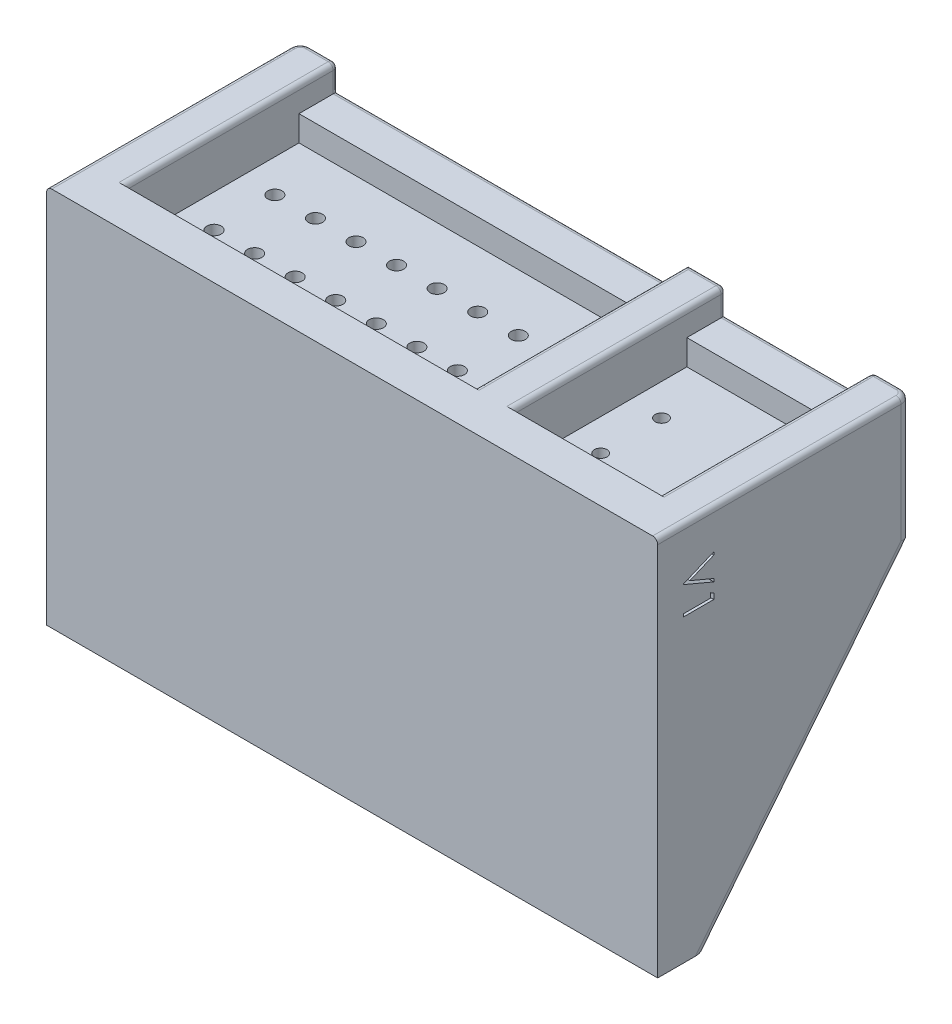
from build123d import *

# Parameters (mm, degrees)
SKETCH1_W           = 120.5
SKETCH1_H           = 50
BOSS_EXTRUDE1_DEPTH = 25
SKETCH2_W           = 29
SKETCH2_H           = 34.5
CUT_EXTRUDE1_DEPTH  = 10
SKETCH3_W           = 69
SKETCH3_H           = 34.5
CUT_EXTRUDE2_DEPTH  = 10
SKETCH5_R           = 1.4
CUT_EXTRUDE4_DEPTH  = 67.933269007
SKETCH6_R           = 1.25
CUT_EXTRUDE5_DEPTH  = 67.933269007
SKETCH8_W           = 69
SKETCH8_H           = 7.75
SKETCH8_W_2         = 29
CUT_EXTRUDE7_DEPTH  = 5
FILLET1_R           = 1
SKETCH9_W           = 120.5
SKETCH9_H           = 10
BOSS_EXTRUDE2_DEPTH = 50
BOSS_EXTRUDE3_DEPTH = 10
FILLET3_R           = 2
SKETCH11_W          = 100.5
SKETCH11_H          = 24
RECESS_DEPTH        = 2
CUT_EXTRUDE9_DEPTH  = 2


with BuildPart() as part:
    # Sketch1 → Boss-Extrude1 (new body)
    with BuildSketch(Plane(origin=(0, 0, 0), x_dir=(1, 0, 0), z_dir=(0, 1, 0))):
        Rectangle(SKETCH1_W, SKETCH1_H)
    extrude(amount=BOSS_EXTRUDE1_DEPTH)

    # Sketch2 → Cut-Extrude1 (cut)
    with BuildSketch(Plane(origin=(0, 25, 0), x_dir=(1, 0, 0), z_dir=(0, 1, 0))):
        with Locations((38.25, 0)):
            Rectangle(SKETCH2_W, SKETCH2_H)
    extrude(amount=-CUT_EXTRUDE1_DEPTH, mode=Mode.SUBTRACT)

    # Sketch3 → Cut-Extrude2 (cut)
    with BuildSketch(Plane(origin=(0, 25, 0), x_dir=(1, 0, 0), z_dir=(0, 1, 0))):
        with Locations((-18.25, 0)):
            Rectangle(SKETCH3_W, SKETCH3_H)
    extrude(amount=-CUT_EXTRUDE2_DEPTH, mode=Mode.SUBTRACT)

    # Sketch5 → Cut-Extrude4 (cut, through all)
    with BuildSketch(Plane(origin=(0, 15, 0), x_dir=(1, 0, 0), z_dir=(0, 1, 0))):
        with Locations(Location((-46.25, 6, 0), (0, 0, 270))):
            Circle(SKETCH5_R)
        with Locations(Location((-38.25, 6, 0), (0, 0, 270))):
            Circle(SKETCH5_R)
        with Locations(Location((-30.25, 6, 0), (0, 0, 270))):
            Circle(SKETCH5_R)
        with Locations(Location((-22.25, 6, 0), (0, 0, 270))):
            Circle(SKETCH5_R)
        with Locations(Location((-14.25, 6, 0), (0, 0, 270))):
            Circle(SKETCH5_R)
        with Locations(Location((-6.25, 6, 0), (0, 0, 270))):
            Circle(SKETCH5_R)
        with Locations(Location((1.75, 6, 0), (0, 0, 270))):
            Circle(SKETCH5_R)
        with Locations(Location((9.75, 6, 0), (0, 0, 270))):
            Circle(SKETCH5_R)
        with Locations(Location((-38.25, -6, 0), (0, 0, 270))):
            Circle(SKETCH5_R)
        with Locations(Location((-30.25, -6, 0), (0, 0, 270))):
            Circle(SKETCH5_R)
        with Locations(Location((-22.25, -6, 0), (0, 0, 270))):
            Circle(SKETCH5_R)
        with Locations(Location((-14.25, -6, 0), (0, 0, 270))):
            Circle(SKETCH5_R)
        with Locations(Location((-6.25, -6, 0), (0, 0, 270))):
            Circle(SKETCH5_R)
        with Locations(Location((1.75, -6, 0), (0, 0, 270))):
            Circle(SKETCH5_R)
        with Locations(Location((9.75, -6, 0), (0, 0, 270))):
            Circle(SKETCH5_R)
        with Locations(Location((-46.25, -6, 0), (0, 0, 270))):
            Circle(SKETCH5_R)
    extrude(amount=-CUT_EXTRUDE4_DEPTH, mode=Mode.SUBTRACT)

    # Sketch6 → Cut-Extrude5 (cut, through all)
    with BuildSketch(Plane(origin=(0, 15, 0), x_dir=(1, 0, 0), z_dir=(0, 1, 0))):
        with Locations(Location((30, 6, 0), (0, 0, 270))):
            Circle(SKETCH6_R)
        with Locations(Location((46, 6, 0), (0, 0, 270))):
            Circle(SKETCH6_R)
    cut_extrude5 = extrude(amount=-CUT_EXTRUDE5_DEPTH, mode=Mode.SUBTRACT)

    # Mirror3: Cut-Extrude5 across plane
    add(cut_extrude5.mirror(Plane.XY), mode=Mode.SUBTRACT)

    # Sketch8 → Cut-Extrude7 (cut)
    with BuildSketch(Plane(origin=(0, 25, 0), x_dir=(1, 0, 0), z_dir=(0, 1, 0))):
        with Locations((-18.25, 21.125)):
            Rectangle(SKETCH8_W, SKETCH8_H)
        with Locations((38.25, 21.125)):
            Rectangle(SKETCH8_W_2, SKETCH8_H)
    extrude(amount=-CUT_EXTRUDE7_DEPTH, mode=Mode.SUBTRACT)

    # Fillet1
    fillet1_edges = [part.edges().sort_by_distance(p)[0] for p in [
        (20, 25, -25),
        (-60.25, 25, 0),
        (-56.5, 25, -25),
        (-18.25, 20, -25),
        (-52.75, 22.5, -25),
        (38.25, 20, -25),
        (23.75, 22.5, -25),
        (52.75, 22.5, -25),
        (52.75, 25, -3.875),
        (23.75, 25, -3.875),
        (16.25, 25, -3.875),
        (-52.75, 25, -3.875),
        (60.25, 25, 0),
        (56.5, 25, -25),
    ]]
    fillet(fillet1_edges, radius=FILLET1_R)

    # Sketch9 → Boss-Extrude2 (add)
    with BuildSketch(Plane.XZ):
        with Locations((0, 20)):
            Rectangle(SKETCH9_W, SKETCH9_H)
    extrude(amount=BOSS_EXTRUDE2_DEPTH)

    # Sketch10 → Boss-Extrude3 (add)
    with BuildSketch(Plane.ZY.offset(60.25)):
        Polygon((-25, 0), (15, -50), (15, 0), align=None)
    boss_extrude3 = extrude(amount=-BOSS_EXTRUDE3_DEPTH)

    # Mirror4: Boss-Extrude3 across plane
    add(boss_extrude3.mirror(Plane(origin=(0, 0, 0), x_dir=(0, 0, 1), z_dir=(1, 0, 0))))

    # Fillet3
    # the kernel refuses this fillet: 2 mm, written as the material it takes off along each edge
    with BuildSketch(Plane(origin=(58.25, 25, -23), x_dir=(1, 0, 0), z_dir=(0, 0, 1))) as fillet3_piece_1:
        with BuildLine():
            CenterArc((1, -1), 1, 0, 90)
            Line((2, -1), (2, 0))
            Line((2, 0), (1, 0))
        make_face()
    revolve(axis=Axis((58.25, 25, -23), (0, 1, 0)), revolution_arc=90, mode=Mode.SUBTRACT)
    with BuildSketch(Plane(origin=(-58.25, 25, -23), x_dir=(0, 0, -1), z_dir=(1, 0, 0))) as fillet3_piece_2:
        with BuildLine():
            CenterArc((1, -1), 1, 0, 90)
            Line((2, -1), (2, 0))
            Line((2, 0), (1, 0))
        make_face()
    revolve(axis=Axis((-58.25, 25, -23), (0, 1, 0)), revolution_arc=90, mode=Mode.SUBTRACT)
    with BuildSketch(Plane(origin=(60.25, -5, -25), x_dir=(0, 0, 1), z_dir=(0, 1, 0))) as fillet3_piece_3:
        with BuildLine():
            CenterArc((FILLET3_R, -FILLET3_R), FILLET3_R, 90, 90)
            Line((0, -FILLET3_R), (0, 0))
            Line((0, 0), (FILLET3_R, 0))
        make_face()
    extrude(amount=30, mode=Mode.SUBTRACT)
    with BuildSketch(Plane(origin=(-60.25, -5, -25), x_dir=(0, 0, 1), z_dir=(0, 1, 0))) as fillet3_piece_4:
        with BuildLine():
            CenterArc((FILLET3_R, FILLET3_R), FILLET3_R, 180, 90)
            Line((0, FILLET3_R), (0, 0))
            Line((0, 0), (FILLET3_R, 0))
        make_face()
    extrude(amount=30, mode=Mode.SUBTRACT)
    with BuildSketch(Plane(origin=(-50.25, 3.904344047, -28.123475238), x_dir=(-1, 0, 0), z_dir=(0, -0.7808688094430305, 0.6246950475544242))) as fillet3_piece_5_section:
        with BuildLine():
            CenterArc((FILLET3_R, -FILLET3_R), FILLET3_R, 90, 90)
            Line((0, -FILLET3_R), (0, 0))
            Line((0, 0), (FILLET3_R, 0))
        make_face()
    fillet3_piece_5 = extrude(amount=74.031242374, mode=Mode.PRIVATE)
    fillet3_piece_5 = split(fillet3_piece_5, bisect_by=Plane(origin=(-50.699423068, -24.646092888, 15), z_dir=(0, 0, -1)), keep=Keep.TOP, mode=Mode.PRIVATE)
    fillet3_piece_5 = split(fillet3_piece_5, bisect_by=Plane(origin=(-50.699423068, 0, -4.716874311), z_dir=(0, -1, 0)), keep=Keep.TOP, mode=Mode.PRIVATE)
    add(fillet3_piece_5, mode=Mode.SUBTRACT)
    with BuildSketch(Plane(origin=(-60.25, 3.904344047, -28.123475238), x_dir=(0, 0.6246950475544242, 0.7808688094430305), z_dir=(0, -0.7808688094430305, 0.6246950475544242))) as fillet3_piece_6:
        with BuildLine():
            CenterArc((FILLET3_R, -FILLET3_R), FILLET3_R, 90, 90)
            Line((0, -FILLET3_R), (0, 0))
            Line((0, 0), (FILLET3_R, 0))
        make_face()
    extrude(amount=74.031242374, mode=Mode.SUBTRACT)
    with BuildSketch(Plane(origin=(60.25, 3.904344047, -28.123475238), x_dir=(0, 0.6246950475544242, 0.7808688094430305), z_dir=(0, -0.7808688094430305, 0.6246950475544242))) as fillet3_piece_7:
        with BuildLine():
            CenterArc((FILLET3_R, FILLET3_R), FILLET3_R, 180, 90)
            Line((0, FILLET3_R), (0, 0))
            Line((0, 0), (FILLET3_R, 0))
        make_face()
    extrude(amount=74.031242374, mode=Mode.SUBTRACT)
    with BuildSketch(Plane(origin=(50.25, 3.904344047, -28.123475238), x_dir=(1, 0, 0), z_dir=(0, -0.7808688094430305, 0.6246950475544242))) as fillet3_piece_8_section:
        with BuildLine():
            CenterArc((FILLET3_R, FILLET3_R), FILLET3_R, 180, 90)
            Line((0, FILLET3_R), (0, 0))
            Line((0, 0), (FILLET3_R, 0))
        make_face()
    fillet3_piece_8 = extrude(amount=74.031242374, mode=Mode.PRIVATE)
    fillet3_piece_8 = split(fillet3_piece_8, bisect_by=Plane(origin=(50.699423068, -24.646092888, 15), z_dir=(0, 0, -1)), keep=Keep.TOP, mode=Mode.PRIVATE)
    fillet3_piece_8 = split(fillet3_piece_8, bisect_by=Plane(origin=(50.699423068, 0, -4.716874311), z_dir=(0, -1, 0)), keep=Keep.TOP, mode=Mode.PRIVATE)
    add(fillet3_piece_8, mode=Mode.SUBTRACT)

    # Sketch11 → Recess (cut)
    with BuildSketch(Plane.XZ):
        Rectangle(SKETCH11_W, SKETCH11_H)
    extrude(amount=-RECESS_DEPTH, mode=Mode.SUBTRACT)

    # Sketch12 → Cut-Extrude9 (cut)
    with BuildSketch(Plane(origin=(60.25, 0, 0), x_dir=(0, 0, -1), z_dir=(1, 0, 0))):
        Polygon((-13.940758113, 17.276238766), (-13.940758113, 16.699315689), (-18.669123497, 14.699315689), (-13.940758113, 12.699315689), (-13.940758113, 12.122392612), (-19.940758113, 14.660854151), (-19.940758113, 14.737777228), align=None)
        Polygon((-13.940758113, 10.231767612), (-13.940758113, 9.122392612), (-19.940758113, 9.122392612), (-19.940758113, 9.660854151), (-14.556142728, 9.660854151), (-14.556142728, 10.583931074), align=None)
    extrude(amount=-CUT_EXTRUDE9_DEPTH, mode=Mode.SUBTRACT)


solid = part.part
